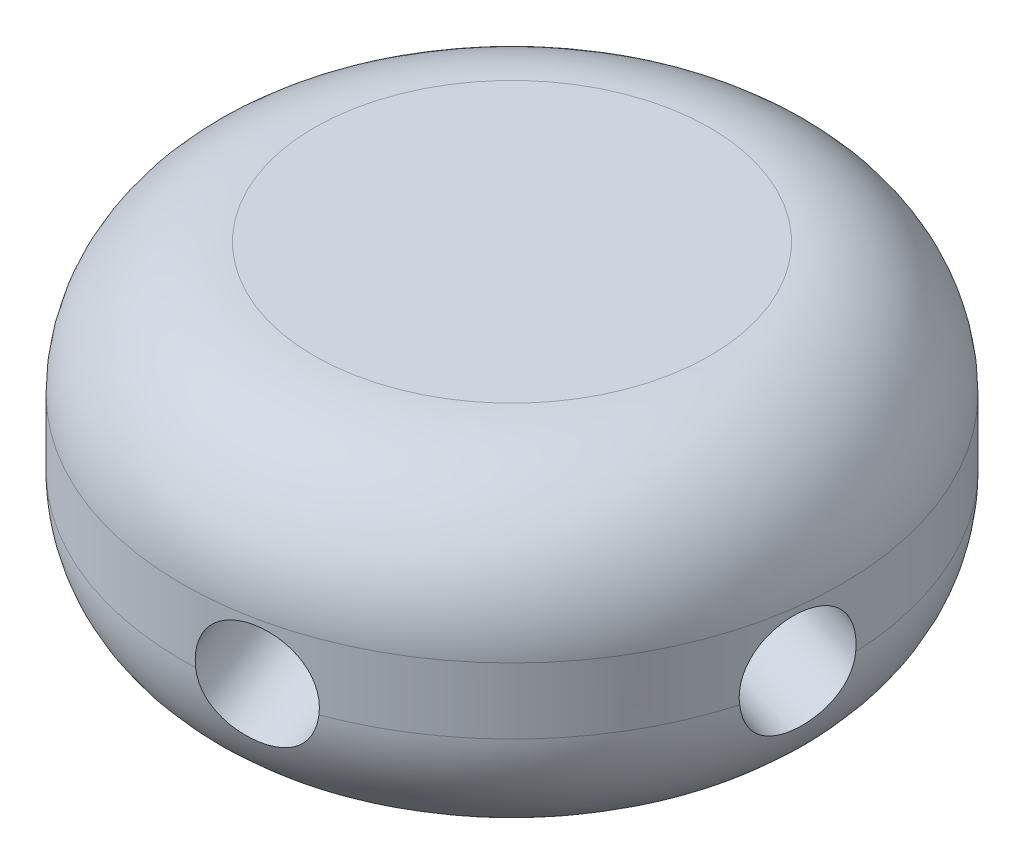
from build123d import *

# Parameters (mm, degrees)
BOSS_EXTRUDE1_DEPTH      = 3
BOSS_EXTRUDE1_DEPTH_BACK = 7
SKETCH1_R                = 10
SKETCH4_R                = 1.6
HOLE_DEPTH               = 19.828402711
HOLECIR_COUNT            = 5
FILLET2_R                = 4


with BuildPart() as part:
    # Sketch1 → Boss-Extrude1 (new, two sides: drawn at the far end of the back side and taken through both)
    with BuildSketch(Plane(origin=(0, 0, 0), x_dir=(1, 0, 0), z_dir=(0, 1, 0)).offset(-BOSS_EXTRUDE1_DEPTH_BACK)):
        with Locations(Location((0, 0, 0), (0, 0, 270))):
            Circle(SKETCH1_R)
    extrude(amount=BOSS_EXTRUDE1_DEPTH + BOSS_EXTRUDE1_DEPTH_BACK)

    # Sketch4 → hole (cut, through all)
    with BuildSketch(Plane(origin=(-3.352872105, -1.093066116, 1.887711608), x_dir=(-0.4486862613641547, -0.14627571033740308, -0.8816371449912632), z_dir=(0.8382180262940947, 0.2732665289126682, -0.47192790187872385))):
        with Locations(Location((0, 0, 0), (0, 0, 8.746528197))):
            Circle(SKETCH4_R)
    hole = extrude(amount=-HOLE_DEPTH, mode=Mode.SUBTRACT)

    # holecir: hole ×5 about axis
    holecir_axis = Axis((0, 0, 0), (0, 1, 0))
    for i in range(1, HOLECIR_COUNT):
        add(hole.rotate(holecir_axis, i * 360 / HOLECIR_COUNT), mode=Mode.SUBTRACT)

    # Fillet2
    # the kernel refuses this fillet: 4 mm, written as the material it takes off along each edge
    with BuildSketch(Plane(origin=(0, -7, 0), x_dir=(0, 0, 1), z_dir=(-1, 0, 0))) as fillet2_piece_1:
        with BuildLine():
            CenterArc((10 - FILLET2_R, FILLET2_R), FILLET2_R, 270, 90)
            Line((10 - FILLET2_R, 0), (10, 0))
            Line((10, 0), (10, FILLET2_R))
        make_face()
    revolve(axis=Axis((0, -7, 0), (0, 1, 0)), mode=Mode.SUBTRACT)
    with BuildSketch(Plane(origin=(0, 3, 0), x_dir=(0, 0, 1), z_dir=(-1, 0, 0))) as fillet2_piece_2:
        with BuildLine():
            CenterArc((10 - FILLET2_R, -FILLET2_R), FILLET2_R, 0, 90)
            Line((10 - FILLET2_R, 0), (10, 0))
            Line((10, 0), (10, -FILLET2_R))
        make_face()
    revolve(axis=Axis((0, 3, 0), (0, 1, 0)), mode=Mode.SUBTRACT)


solid = part.part
